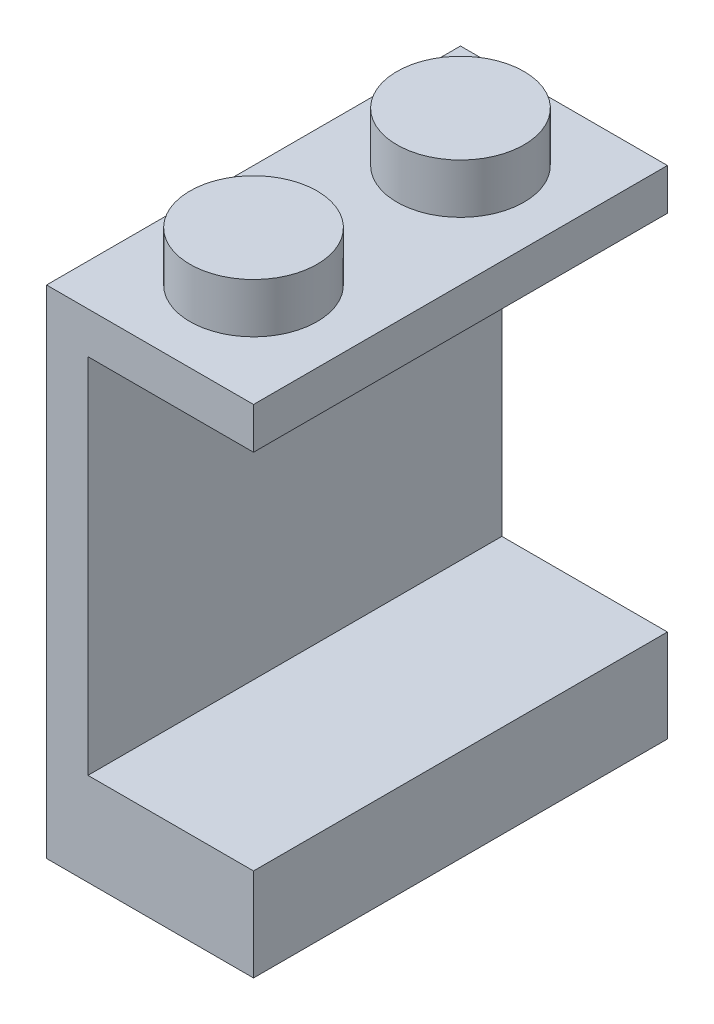
from build123d import *

# Parameters (mm, degrees)
SKETCH1_W           = 7.9375
SKETCH1_H           = 15.875
BASE_EXTRUDE_DEPTH  = 19.05
SKETCH2_R           = 2.4384
BOSS_EXTRUDE1_DEPTH = 1.905
LPATTERN6_COUNT     = 2
LPATTERN6_PITCH     = 7.9375
SKETCH4_W           = 4.7625
SKETCH4_H           = 12.7
CUT_EXTRUDE1_DEPTH  = 1.5875
INSDOT_REACH        = 24.757
SKETCH3_R           = 2.032
SKETCH3_R_2         = 1.27
SKETCH5_W           = 6.35
SKETCH5_H           = 13.9065
CUT_EXTRUDE2_DEPTH  = 27.587189144


with BuildPart() as part:
    # Sketch1 → Base-Extrude (new body)
    with BuildSketch(Plane(origin=(0, 0, 0), x_dir=(1, 0, 0), z_dir=(0, 1, 0))):
        Rectangle(SKETCH1_W, SKETCH1_H)
    extrude(amount=BASE_EXTRUDE_DEPTH)

    # Sketch2 → Boss-Extrude1 (add)
    with BuildSketch(Plane(origin=(0, 19.05, 0), x_dir=(-1, 0, 0), z_dir=(0, 1, 0))):
        with Locations((0, 3.96875)):
            Circle(SKETCH2_R)
    boss_extrude1 = extrude(amount=BOSS_EXTRUDE1_DEPTH)

    # LPattern6: Boss-Extrude1 ×2
    with Locations(*[(0, 0, -i * LPATTERN6_PITCH) for i in range(1, LPATTERN6_COUNT)]):
        add(boss_extrude1)

    # Sketch4 → Cut-Extrude1 (cut)
    with BuildSketch(Plane.XZ):
        Rectangle(SKETCH4_W, SKETCH4_H)
    extrude(amount=-CUT_EXTRUDE1_DEPTH, mode=Mode.SUBTRACT)

    # Sketch3 → InsDot (add, up to next)
    with BuildSketch(Plane.XZ, mode=Mode.PRIVATE) as insdot_sk1:
        Circle(SKETCH3_R)
        Circle(SKETCH3_R_2, mode=Mode.SUBTRACT)
    insdot_tool1 = extrude(insdot_sk1.sketch, amount=-INSDOT_REACH, mode=Mode.PRIVATE) - part.part
    add(insdot_tool1.solids().sort_by_distance((-1.974526, 0, 0))[0])

    # Sketch5 → Cut-Extrude2 (cut, through all)
    with BuildSketch(Plane.XY.offset(7.9375)):
        with Locations((0.79375, 10.50925)):
            Rectangle(SKETCH5_W, SKETCH5_H)
    extrude(amount=-CUT_EXTRUDE2_DEPTH, mode=Mode.SUBTRACT)


solid = part.part
